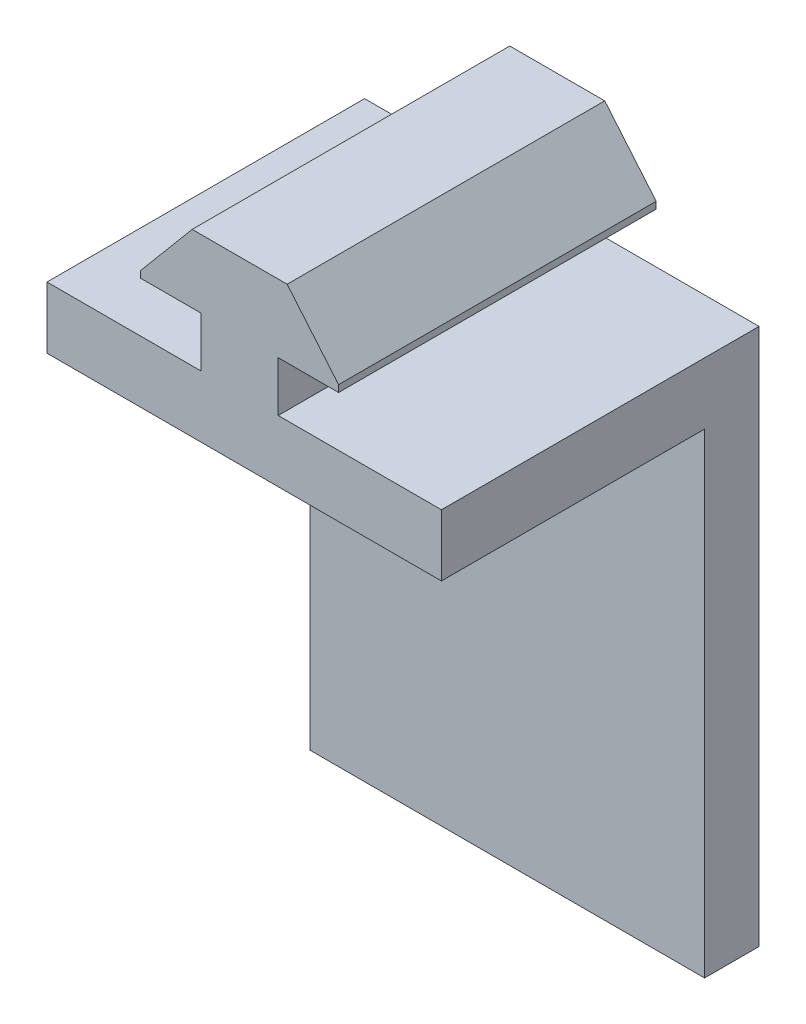
from build123d import *

# Parameters (mm, degrees)
BOSS_EXTRUDE1_DEPTH = 457.2
SKETCH2_W           = 42.050956734
SKETCH2_H           = 23.599286926
CUT_EXTRUDE1_DEPTH  = 800
SKETCH3_W           = 114.4
SKETCH3_H           = 56.436670765
BOSS_EXTRUDE2_DEPTH = 10
SKETCH4_W           = 114.4
SKETCH4_H           = 4.244670765
CUT_EXTRUDE2_DEPTH  = 10
SKETCH7_W           = 48.1
SKETCH7_H           = 52.192
CUT_EXTRUDE3_DEPTH  = 42
SKETCH8_W           = 0.9
SKETCH8_H           = 40
CUT_EXTRUDE4_DEPTH  = 90
SPLIT1_START        = 342.8
SPLIT1_DEPTH        = 72.4
SPLIT1_START_2      = 19.95
SPLIT1_2_OUTLINE_W  = 52.192
SPLIT1_2_OUTLINE_H  = 72.4
SPLIT1_2_DEPTH      = 9.1
SPLIT1_START_3      = -19.05
SPLIT1_3_OUTLINE_W  = 17.78
SPLIT1_3_OUTLINE_H  = 72.4
SPLIT1_3_DEPTH      = 48.1
SPLIT1_4_OUTLINE_W  = 34.412
SPLIT1_4_OUTLINE_H  = 72.4
SPLIT1_4_DEPTH      = 9.1
SKETCH9_W           = 43.051140559
SKETCH9_H           = 19.836335545
CUT_EXTRUDE5_DEPTH  = 41
SKETCH10_W          = 39
SKETCH10_H          = 5.38616804
BOSS_EXTRUDE3_DEPTH = 47


# Read off the part's stored shape, not the designer's step: Split1
with BuildPart() as part:
    # Sketch1 → Boss-Extrude1 (new, symmetric)
    with BuildSketch(Plane.XY):
        Polygon((-19.05, 8.89), (19.05, 8.89), (19.05, 2.794), (3.81, 2.794), (3.81, -2.159), (9.779, -2.159), (9.779, -2.8321), (4.695818344, -8.89), (-4.695818344, -8.89), (-9.779, -2.8321), (-9.779, -2.159), (-3.81, -2.159), (-3.81, 2.794), (-19.05, 2.794), align=None)
    boss_extrude1 = extrude(amount=BOSS_EXTRUDE1_DEPTH, both=True)

    # Sketch2 → Cut-Extrude1 (cut)
    with BuildSketch(Plane(origin=(0, 0, -457.2), x_dir=(-1, 0, 0), z_dir=(0, 0, -1))):
        Rectangle(SKETCH2_W, SKETCH2_H)
    cut_extrude1 = extrude(amount=-CUT_EXTRUDE1_DEPTH, mode=Mode.SUBTRACT)

    # Sketch3 → Boss-Extrude2 (add)
    with BuildSketch(Plane(origin=(19.05, 0, 0), x_dir=(0, 0, -1), z_dir=(1, 0, 0))):
        with Locations((-400, -19.328335383)):
            Rectangle(SKETCH3_W, SKETCH3_H)
    extrude(amount=BOSS_EXTRUDE2_DEPTH)

    # Mirror1: Boss-Extrude1, Cut-Extrude1 across plane
    add(boss_extrude1.mirror(Plane(origin=(0, -17.206, 0), x_dir=(0, 0, 1), z_dir=(0, -1, 0))))
    add(cut_extrude1.mirror(Plane(origin=(0, -17.206, 0), x_dir=(0, 0, 1), z_dir=(0, -1, 0))), mode=Mode.SUBTRACT)

    # Sketch4 → Cut-Extrude2 (cut)
    with BuildSketch(Plane.ZY.offset(-19.05)):
        with Locations((400, -45.424335383)):
            Rectangle(SKETCH4_W, SKETCH4_H)
    extrude(amount=-CUT_EXTRUDE2_DEPTH, mode=Mode.SUBTRACT)

    # Sketch7 → Cut-Extrude3 (cut)
    with BuildSketch(Plane.XY.offset(457.2)):
        with Locations((5, -17.206)):
            Rectangle(SKETCH7_W, SKETCH7_H)
    extrude(amount=-CUT_EXTRUDE3_DEPTH, mode=Mode.SUBTRACT)

    # Sketch8 → Cut-Extrude4 (cut)
    with BuildSketch(Plane(origin=(0, 0, 342.8), x_dir=(-1, 0, 0), z_dir=(0, 0, -1))):
        with Locations((-19.5, -17.206)):
            Rectangle(SKETCH8_W, SKETCH8_H)
    extrude(amount=-CUT_EXTRUDE4_DEPTH, mode=Mode.SUBTRACT)

    # Split1 3 outline → Split1 3 (cut)
    with BuildSketch(Plane.YZ.offset(SPLIT1_START_3)):
        with Locations((0, 379)):
            Rectangle(SPLIT1_3_OUTLINE_W, SPLIT1_3_OUTLINE_H)
    extrude(amount=SPLIT1_3_DEPTH, mode=Mode.SUBTRACT)

    # Split1 4 outline → Split1 4 (cut)
    with BuildSketch(Plane.YZ.offset(SPLIT1_START_2)):
        with Locations((-26.096, 379)):
            Rectangle(SPLIT1_4_OUTLINE_W, SPLIT1_4_OUTLINE_H)
    extrude(amount=SPLIT1_4_DEPTH, mode=Mode.SUBTRACT)


with BuildPart() as body_2:
    # Split1 outline → Split1 (new body)
    with BuildSketch(Plane.XY.offset(SPLIT1_START)):
        Polygon((19.95, 2.794), (19.95, 8.89), (-19.05, 8.89), (-19.05, 2.794), (-3.81, 2.794), (-3.81, -2.159), (-9.779, -2.159), (-9.779, -2.8321), (-4.695818344, -8.89), (4.695818344, -8.89), (9.779, -2.8321), (9.779, -2.159), (3.81, -2.159), (3.81, 2.794), align=None)
    extrude(amount=SPLIT1_DEPTH)


with BuildPart() as body_3:
    # Split1 2 outline → Split1 2 (new body)
    with BuildSketch(Plane.YZ.offset(SPLIT1_START_2)):
        with Locations((-17.206, 379)):
            Rectangle(SPLIT1_2_OUTLINE_W, SPLIT1_2_OUTLINE_H)
    extrude(amount=SPLIT1_2_DEPTH)


with BuildPart() as part_1:
    add(part.part)

    # Combine1: cut body 3, body 2
    add(body_3.part, mode=Mode.SUBTRACT)
    add(body_2.part, mode=Mode.SUBTRACT)

    # Sketch9 → Cut-Extrude5 (cut)
    with BuildSketch(Plane.XY.offset(415.2)):
        with Locations((2.47557028, -33.383832228)):
            Rectangle(SKETCH9_W, SKETCH9_H)
    extrude(amount=-CUT_EXTRUDE5_DEPTH, mode=Mode.SUBTRACT)

    # Sketch10 → Boss-Extrude3 (add)
    with BuildSketch(Plane(origin=(0, -43.302, 0), x_dir=(-1, 0, 0), z_dir=(0, -1, 0))):
        with Locations((-0.45, -345.49308402)):
            Rectangle(SKETCH10_W, SKETCH10_H)
    extrude(amount=BOSS_EXTRUDE3_DEPTH)


solid = part_1.part
